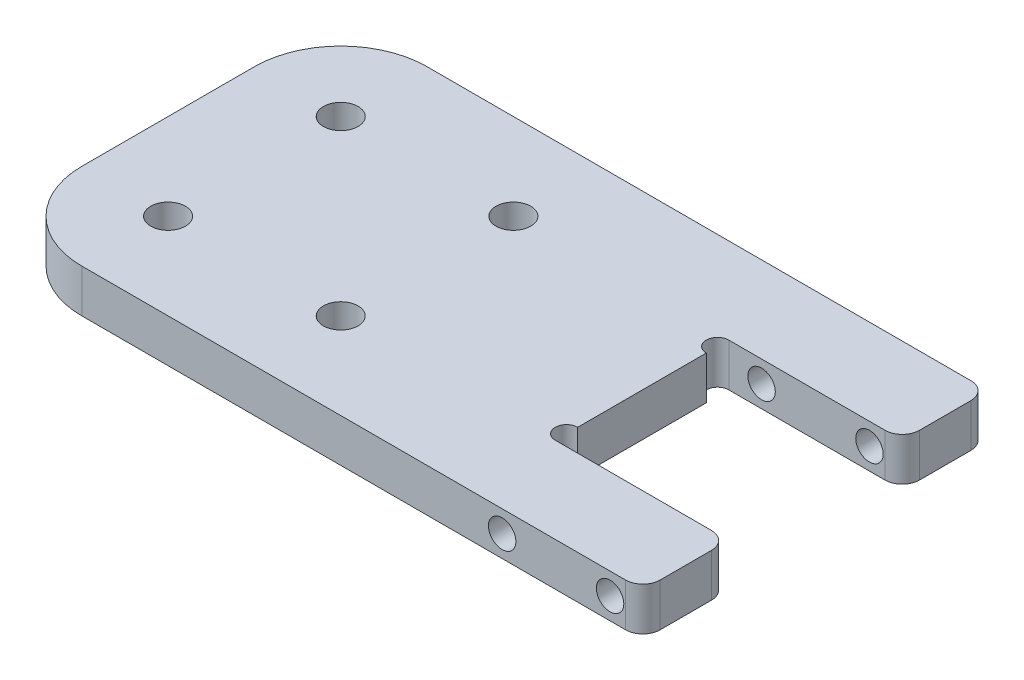
from build123d import *

# Parameters (mm, degrees)
BOSS_EXTRUDE1_DEPTH    = 6.35
F_10_CLEARANCE_HOLE1_D = 5.1054
SKETCH5_W              = 25.527
SKETCH5_H              = 25.527
CUT_EXTRUDE1_DEPTH     = 66.761600688
CUT_EXTRUDE2_DEPTH     = 66.761600688
FILLET1_R              = 2.54
FILLET2_R              = 12.7
F_10_32_TAPPED_HOLE1_D = 4.0386


with BuildPart() as part:
    # Sketch1 → Boss-Extrude1 (new body)
    with BuildSketch(Plane(origin=(0, 0, 0), x_dir=(1, 0, 0), z_dir=(0, 1, 0))):
        Polygon((34.925, 25.4), (60.325, 25.4), (60.325, -25.4), (34.925, -25.4), (-34.925, -25.4), (-34.925, 25.4), align=None)
    extrude(amount=BOSS_EXTRUDE1_DEPTH)

    # #10 Clearance Hole1 (through all)
    with Locations(Plane(origin=(0, 6.35, 0), x_dir=(1, 0, 0), z_dir=(0, 1, 0))):
        with Locations((-22.225, 12.7), (3.175, 12.7), (3.175, -12.7), (-22.225, -12.7)):
            Hole(F_10_CLEARANCE_HOLE1_D / 2)

    # Sketch5 → Cut-Extrude1 (cut, through all)
    with BuildSketch(Plane(origin=(0, 6.35, 0), x_dir=(1, 0, 0), z_dir=(0, 1, 0))):
        with Locations((47.5615, 0)):
            Rectangle(SKETCH5_W, SKETCH5_H)
    extrude(amount=-CUT_EXTRUDE1_DEPTH, mode=Mode.SUBTRACT)

    # Sketch6 → Cut-Extrude2 (cut, through all)
    with BuildSketch(Plane(origin=(0, 6.35, 0), x_dir=(1, 0, 0), z_dir=(0, 1, 0))):
        with BuildLine():
            Line((34.798, 9.4615), (34.798, 12.7635))
            ThreePointArc((34.798, 12.7635), (33.147, 11.1125), (34.798, 9.4615))
        make_face()
        with BuildLine():
            Line((34.798, -9.4615), (34.798, -12.7635))
            ThreePointArc((34.798, -12.7635), (33.147, -11.1125), (34.798, -9.4615))
        make_face()
    extrude(amount=-CUT_EXTRUDE2_DEPTH, mode=Mode.SUBTRACT)

    # Fillet1
    fillet1_edges = [part.edges().sort_by_distance(p)[0] for p in [
        (60.325, 3.175, 12.7635),
        (60.325, 3.175, -12.7635),
        (60.325, 3.175, -25.4),
        (60.325, 3.175, 25.4),
    ]]
    fillet(fillet1_edges, radius=FILLET1_R)

    # Fillet2
    fillet2_edges = [part.edges().sort_by_distance(p)[0] for p in [
        (-34.925, 3.175, -25.4),
        (-34.925, 3.175, 25.4),
    ]]
    fillet(fillet2_edges, radius=FILLET2_R)

    # #10-32 Tapped Hole1 (through all)
    with Locations(Plane.XY.offset(25.4)):
        with Locations((55.499, 3.175), (39.624, 3.175)):
            Hole(F_10_32_TAPPED_HOLE1_D / 2)


solid = part.part
